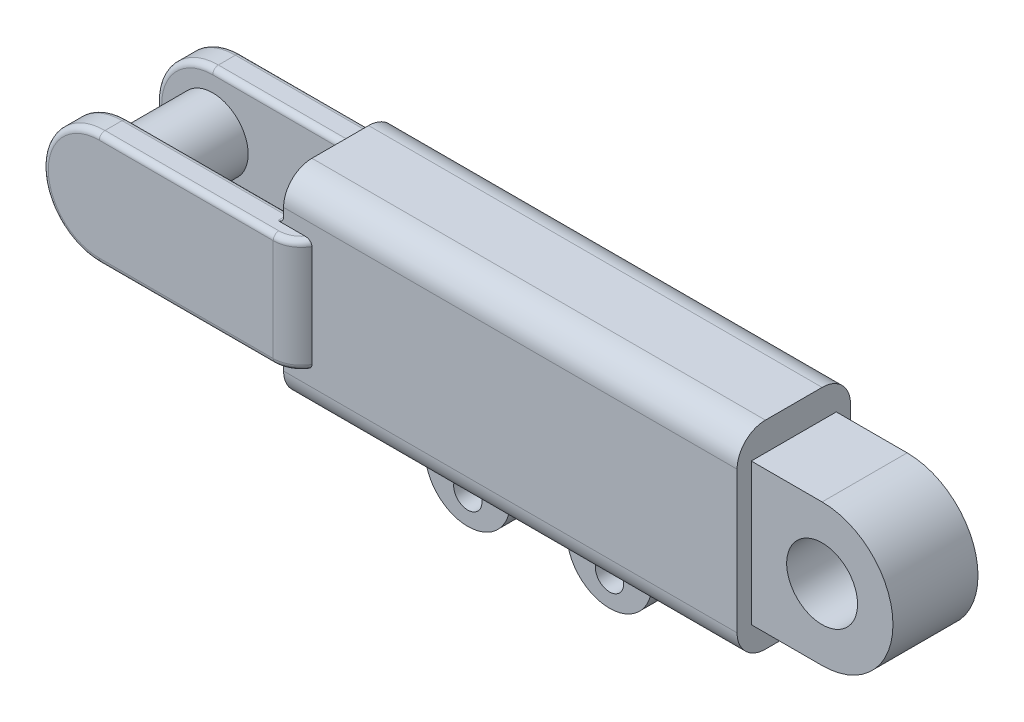
from build123d import *

# Parameters (mm, degrees)
BOSS_EXTRUDE1_DEPTH      = 25
BOSS_EXTRUDE1_DEPTH_BACK = 25
SKETCH2_W                = 30
SKETCH2_H                = 40
CUT_EXTRUDE1_DEPTH       = 96.524865873
BOSS_EXTRUDE2_REACH      = 90.318
SKETCH3_R                = 12.5
STRUCTURAL_MEMBER1_DEPTH = 150
BOSS_EXTRUDE3_DEPTH      = 10
BOSS_EXTRUDE4_DEPTH      = 50
BOSS_EXTRUDE4_DEPTH_BACK = 10
CUT_EXTRUDE6_START       = -30
CUT_EXTRUDE6_DEPTH       = 30
SKETCH16_R               = 12.5
CUT_EXTRUDE7_DEPTH       = 276.181758116
FILLET1_R                = 10
FILLET2_R                = 2
FILLET3_R                = 2
SKETCH19_W               = 30
SKETCH19_H               = 10
BOSS_EXTRUDE6_DEPTH      = 20
FILLET5_R                = 15
SKETCH20_R               = 5
CUT_EXTRUDE9_DEPTH       = 10
LPATTERN2_COUNT          = 2
LPATTERN2_PITCH          = 50
FILLET5_OF_LPATTERN2_R   = 15


# Read off the part's stored shape, not the designer's step: Cut-Extrude6
# Some blends are built 0.0001 mm under size
with BuildPart() as part:
    # Sketch1 → Boss-Extrude1 (new, two sides: drawn at the far end of the back side and taken through both)
    with BuildSketch(Plane.XY.offset(-BOSS_EXTRUDE1_DEPTH_BACK)):
        with BuildLine():
            Line((0, 20), (70, 20))
            Line((70, 20), (70, -20))
            Line((70, -20), (0, -20))
            ThreePointArc((0, -20), (-20, 0), (0, 20))
        make_face()
    extrude(amount=BOSS_EXTRUDE1_DEPTH + BOSS_EXTRUDE1_DEPTH_BACK)

    # Sketch2 → Cut-Extrude1 (cut, through all)
    with BuildSketch(Plane(origin=(70, 0, 0), x_dir=(0, 0, -1), z_dir=(1, 0, 0))):
        Rectangle(SKETCH2_W, SKETCH2_H)
    extrude(amount=-CUT_EXTRUDE1_DEPTH, mode=Mode.SUBTRACT)


with BuildPart() as cut_extrude1_piece_1:
    # of the separate pieces the step leaves, piece 1, a body of its own (cut_extrude1_pieces)
    add(part.part.solids().sort_by_distance((0, 20, -25))[0])

    # Sketch3 → Boss-Extrude2 (add, up to next)
    with BuildSketch(Plane.XY.offset(25), mode=Mode.PRIVATE) as boss_extrude2_sk1:
        Circle(SKETCH3_R)
    boss_extrude2_tool1 = extrude(boss_extrude2_sk1.sketch, amount=-BOSS_EXTRUDE2_REACH, mode=Mode.PRIVATE) - cut_extrude1_piece_1.part


with BuildPart() as cut_extrude1_piece_2:
    # of the separate pieces the step leaves, piece 2, a body of its own (cut_extrude1_pieces)
    add(part.part.solids().sort_by_distance((0, 20, 15))[0])


with BuildPart() as cut_extrude1_piece_1_1:
    add(cut_extrude1_piece_1.part)

    add(cut_extrude1_piece_2.part)  # Boss-Extrude2 merges Cut-Extrude1 piece 2
    add(boss_extrude2_tool1.solids().sort_by_distance((0, 0, 25))[0])



with BuildPart() as body_2:
    # Sketch11 → Structural Member1 (new body)
    with BuildSketch(Plane(origin=(70, 0, 0), x_dir=(0, 0, 1), z_dir=(1, 0, 0))):
        with BuildLine():
            Line((-10, -35), (10, -35))
            ThreePointArc((10, -35), (17.071067812, -32.071067812), (20, -25))
            Line((20, -25), (20, 25))
            ThreePointArc((20, 25), (17.071067812, 32.071067812), (10, 35))
            Line((10, 35), (-10, 35))
            ThreePointArc((-10, 35), (-17.071067812, 32.071067812), (-20, 25))
            Line((-20, 25), (-20, -25))
            ThreePointArc((-20, -25), (-17.071067812, -32.071067812), (-10, -35))
        make_face()
        with BuildLine():
            Line((-10, -30), (10, -30))
            ThreePointArc((10, -30), (13.535533906, -28.535533906), (15, -25))
            Line((15, -25), (15, 25))
            ThreePointArc((15, 25), (13.535533906, 28.535533906), (10, 30))
            Line((10, 30), (-10, 30))
            ThreePointArc((-10, 30), (-13.535533906, 28.535533906), (-15, 25))
            Line((-15, 25), (-15, -25))
            ThreePointArc((-15, -25), (-13.535533906, -28.535533906), (-10, -30))
        make_face(mode=Mode.SUBTRACT)
    extrude(amount=STRUCTURAL_MEMBER1_DEPTH)


with BuildPart() as cut_extrude1_piece_1_2:
    add(cut_extrude1_piece_1_1.part)

    add(body_2.part)  # Boss-Extrude3 merges body 2
    # Sketch12 → Boss-Extrude3 (add)
    with BuildSketch(Plane.ZY.offset(-70)):
        with BuildLine():
            Line((20, -25), (20, 25))
            ThreePointArc((20, 25), (17.071067812, 32.071067812), (10, 35))
            Line((10, 35), (-10, 35))
            ThreePointArc((-10, 35), (-17.071067812, 32.071067812), (-20, 25))
            Line((-20, 25), (-20, -25))
            ThreePointArc((-20, -25), (-17.071067812, -32.071067812), (-10, -35))
            Line((-10, -35), (10, -35))
            ThreePointArc((10, -35), (17.071067812, -32.071067812), (20, -25))
        make_face()
    extrude(amount=BOSS_EXTRUDE3_DEPTH)

    # Sketch14 → Boss-Extrude4 (add, two sides: drawn at the far end of the back side and taken through both)
    with BuildSketch(Plane(origin=(220, 0, 0), x_dir=(0, 0, -1), z_dir=(1, 0, 0)).offset(-BOSS_EXTRUDE4_DEPTH_BACK)):
        with BuildLine():
            Line((15, -25), (15, 25))
            ThreePointArc((15, 25), (13.535533906, 28.535533906), (10, 30))
            Line((10, 30), (-10, 30))
            ThreePointArc((-10, 30), (-13.535533906, 28.535533906), (-15, 25))
            Line((-15, 25), (-15, -25))
            ThreePointArc((-15, -25), (-13.535533906, -28.535533906), (-10, -30))
            Line((-10, -30), (10, -30))
            ThreePointArc((10, -30), (13.535533906, -28.535533906), (15, -25))
        make_face()
    extrude(amount=BOSS_EXTRUDE4_DEPTH + BOSS_EXTRUDE4_DEPTH_BACK)

    # Cut-Extrude6 outline → Cut-Extrude6 (cut)
    with BuildSketch(Plane.XY.offset(15).offset(CUT_EXTRUDE6_START)):
        with BuildLine():
            Line((220, -25), (220, -30))
            Line((220, -30), (270, -30))
            Line((270, -30), (270, -2.73e-07))
            ThreePointArc((270, -2.73e-07), (262.677669433, -17.677669626), (245, -25))
            Line((245, -25), (220, -25))
        make_face()
        with BuildLine():
            Line((220, 30), (220, 25))
            Line((220, 25), (245, 25))
            ThreePointArc((245, 25), (262.677669626, 17.677669433), (270, -2.73e-07))
            Line((270, -2.73e-07), (270, 30))
            Line((270, 30), (220, 30))
        make_face()
    extrude(amount=CUT_EXTRUDE6_DEPTH, mode=Mode.SUBTRACT)

    # Sketch16 → Cut-Extrude7 (cut, through all)
    with BuildSketch(Plane.XY.offset(15)):
        with Locations((245, 0)):
            Circle(SKETCH16_R)
    extrude(amount=-CUT_EXTRUDE7_DEPTH, mode=Mode.SUBTRACT)

    # Fillet1
    # the kernel refuses this fillet: 10 mm, written as the material it takes off along each edge
    with BuildSketch(Plane(origin=(70, 41.650635095, -25), x_dir=(0, 0, 1), z_dir=(0, -1, 0))) as fillet1_piece_1:
        with BuildLine():
            CenterArc((10, 8.660254038), FILLET1_R, 180, 60)
            Line((0, 8.660254038), (-0.2, 8.660254038))
            Line((-0.2, 8.660254038), (-0.2, 0))
            Line((-0.2, 0), (0, -0.2))
            ThreePointArc((0, -0.2), (2.5, -0.2), (4.9, -0.173205081))
            Line((4.9, -0.173205081), (5, 0))
        make_face()
    extrude(amount=83.301270189, mode=Mode.SUBTRACT)
    with BuildSketch(Plane(origin=(70, 41.650635095, 25), x_dir=(0, 0, -1), z_dir=(0, -1, 0))) as fillet1_piece_2:
        with BuildLine():
            CenterArc((10, -8.660254038), FILLET1_R, 120, 60)
            Line((0, -8.660254038), (-0.2, -8.660254038))
            Line((-0.2, -8.660254038), (-0.2, 0))
            Line((-0.2, 0), (0, 0.2))
            ThreePointArc((0, 0.2), (2.5, 0.2), (4.9, 0.173205081))
            Line((4.9, 0.173205081), (5, 0))
        make_face()
    extrude(amount=83.301270189, mode=Mode.SUBTRACT)

    # Fillet2
    fillet2_edges = [cut_extrude1_piece_1_2.edges().sort_by_distance(p)[0] for p in [
        (-12.5, 0, 15),
        (30, 20, -15),
        (-20, 0, -15),
        (30, -20, -15),
        (-20, 0, 15),
        (30, 20, 15),
        (60, 0, -15),
        (30, -20, 15),
        (60, 0, 15),
        (60, 20, 17.5),
        (60, 20, -17.5),
        (60, -20, -17.5),
        (60, -20, 17.5),
    ]]
    fillet(fillet2_edges, radius=FILLET2_R)

    # Fillet3
    fillet3_edges = [cut_extrude1_piece_1_2.edges().sort_by_distance(p)[0] for p in [
        (66.339745962, 20, 23.660254038),
        (30.669872981, 20, 25),
        (-20, 0, 25),
        (66.339745962, -20, 23.660254038),
        (66.339745962, 20, -23.660254038),
        (30.669872981, 20, -25),
        (-20, 0, -25),
        (66.339745962, -20, -23.660254038),
        (30.669872981, -20, 25),
        (30.669872981, -20, -25),
    ]]
    fillet(fillet3_edges, radius=FILLET3_R)


with BuildPart() as body_2_2:
    # Sketch19 → Boss-Extrude6 (new body)
    with BuildSketch(Plane.XZ.offset(35)):
        with Locations((110, 0)):
            Rectangle(SKETCH19_W, SKETCH19_H)
    boss_extrude6 = extrude(amount=BOSS_EXTRUDE6_DEPTH)

    # Fillet5
    fillet5_edges = [body_2_2.edges().sort_by_distance(p)[0] for p in [
        (95, -55, 0),
        (125, -55, 0),
    ]]
    fillet(fillet5_edges, radius=FILLET5_R - 0.0001)  # a hair under: the kernel refuses the full size

    # Sketch20 → Cut-Extrude9 (cut)
    with BuildSketch(Plane.XY.offset(5)):
        with Locations((110, -45)):
            Circle(SKETCH20_R)
    cut_extrude9 = extrude(amount=-CUT_EXTRUDE9_DEPTH, mode=Mode.SUBTRACT)


with BuildPart() as cut_extrude1_piece_1_3:
    add(cut_extrude1_piece_1_2.part)

    # LPattern2: Boss-Extrude6, Cut-Extrude9 ×2
    with Locations(*[(i * LPATTERN2_PITCH, 0, 0) for i in range(1, LPATTERN2_COUNT)]):
        add(boss_extrude6)
        add(cut_extrude9, mode=Mode.SUBTRACT)

    # Fillet5 of LPattern2
    fillet5_of_lpattern2_edges = [cut_extrude1_piece_1_3.edges().sort_by_distance(p)[0] for p in [
        (145, -55, 0),
        (175, -55, 0),
    ]]
    fillet(fillet5_of_lpattern2_edges, radius=FILLET5_OF_LPATTERN2_R - 0.0001)  # a hair under: the kernel refuses the full size


solid = Compound([body_2_2.part, cut_extrude1_piece_1_3.part])
